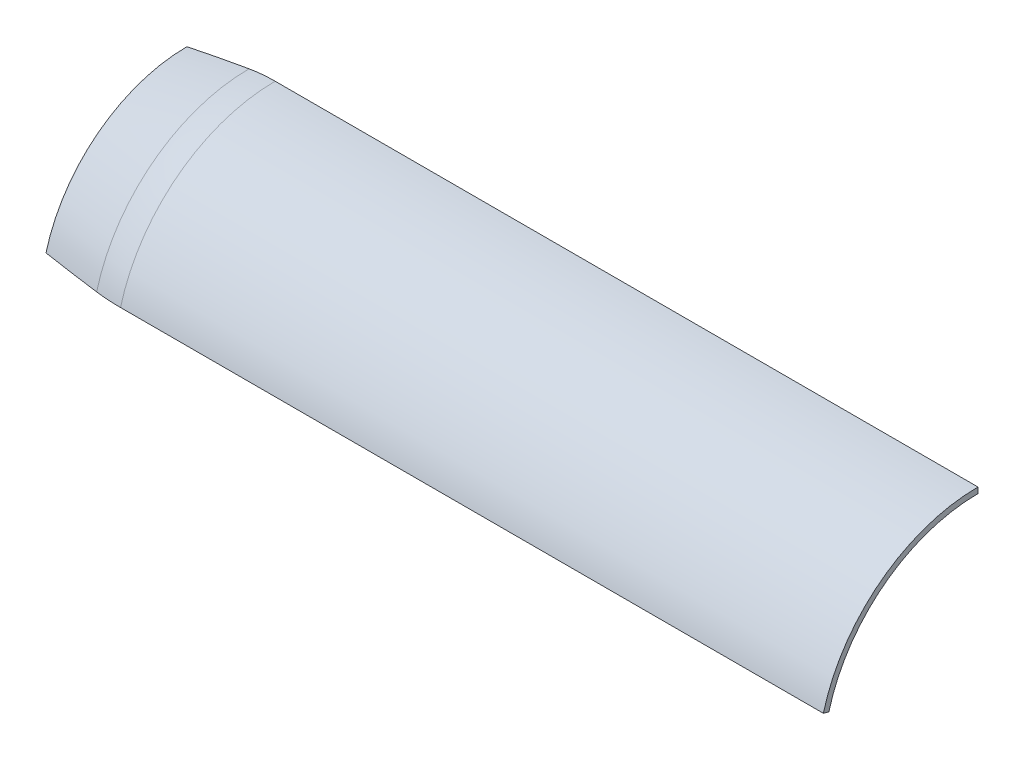
from build123d import *

# Parameters (mm, degrees)
REVOLVE1_ANGLE     = 75
FILLET1_R          = 80
FILLET2_R          = 80
SKETCH3_W          = 220
SKETCH3_H          = 208.906104004
CUT_EXTRUDE3_DEPTH = 159


with BuildPart() as part:
    # Sketch1 → Revolve1 (revolve)
    with BuildSketch(Plane.XY):
        with BuildLine():
            Line((0, 0), (3.000014971, 0))
            Line((3.000014971, 0), (2.999985029, 0.009477573))
            add(Edge.make_bspline(
                [(2.999985029, 0.009477573), (2.993785153, 1.971956174), (2.98195041, 5.919056141), (3.145368661, 11.706950418), (3.673805689, 17.348455242), (4.826995442, 22.758009885), (6.767385374, 27.848912294), (10.462264152, 34.106073266), (16.932254921, 40.80886219), (26.377617743, 47.258644811), (36.67301066, 52.572311975), (47.441384771, 57.081049673), (62.17748954, 62.31037411), (81.042213455, 67.757539775), (104.018152235, 73.218909741), (126.982089983, 77.893970447), (142.347775171, 80.65244689), (149.958103424, 81.949720096), (150, 81.956859546)],
                knots=[0, 0, 0, 0, 0.03125, 0.0625, 0.09375, 0.125, 0.15625, 0.1875, 0.25, 0.3125, 0.375, 0.4375, 0.5, 0.625, 0.75, 0.875, 0.996633751, 0.997307001, 0.997307001, 0.997307001, 0.997307001], degree=3))
            Line((150, 81.956859546), (530, 81.956859546))
            Line((530, 81.956859546), (530, 85))
            Line((530, 85), (150, 85))
            add(Edge.make_bspline(
                [(0, 0), (-0.012294225, 3.891554312), (-0.027437579, 8.684958126), (0.361573767, 14.085722357), (0.576098453, 16.090496183), (0.782493435, 17.604822189), (0.986227589, 18.854298664), (1.188670863, 19.931536976), (1.390404268, 20.885679324), (1.591698837, 21.746529091), (1.792703864, 22.533746067), (1.993507167, 23.261083862), (2.253808552, 24.139979457), (2.580573656, 25.146175179), (2.983585386, 26.259501153), (3.385879093, 27.271261727), (3.787683439, 28.201566994), (4.189138614, 29.064817448), (4.590335615, 29.871726974), (5.05331092, 30.74778076), (5.583218589, 31.683457084), (6.185429632, 32.669732492), (6.787226927, 33.590624245), (7.451481511, 34.546094958), (8.182770444, 35.530963646), (8.985083876, 36.540013411), (9.850344603, 37.562485558), (10.782608842, 38.595746542), (11.785011743, 39.636928062), (12.851029789, 40.680352273), (13.983960321, 41.72463117), (15.186170623, 42.768194245), (16.387975322, 43.755294725), (17.654380903, 44.743506811), (18.987602276, 45.731471932), (20.389198856, 46.717890971), (21.790522044, 47.657861765), (23.257103599, 48.59836715), (24.790441056, 49.538186318), (26.391587757, 50.476245251), (28.05829275, 51.412163763), (29.791720393, 52.345056651), (31.59268286, 53.274185034), (33.459445798, 54.199628429), (35.392909821, 55.120726442), (37.459746918, 56.067201212), (39.59327023, 57.006562681), (41.860151348, 57.96659169), (44.193707143, 58.917521836), (46.660609333, 59.885320784), (49.260404933, 60.867669295), (51.99403381, 61.861671206), (54.860992187, 62.865616104), (57.794602823, 63.85555089), (60.861539281, 64.853573463), (64.06149587, 65.858380358), (67.461497598, 66.888166734), (70.995135905, 67.920234745), (74.662088876, 68.953918346), (78.462130407, 69.988575944), (82.462197069, 71.040436012), (86.662284614, 72.107100186), (91.062388571, 73.18640193), (95.662505252, 74.276388609), (100.462631288, 75.375305679), (105.462763855, 76.481579791), (110.662900527, 77.593803027), (116.063039296, 78.710717608), (121.663178505, 79.831201671), (127.529872228, 80.967142806), (133.663251007, 82.116215238), (140.063409966, 83.276352633), (145.198462089, 84.177415336), (148.333178957, 84.715838785), (149.39998937, 84.897876633), (149.733326587, 84.954653305), (149.933332963, 84.98866355), (150, 85)],
                knots=[0, 0, 0, 0, 0.061462209, 0.075705788, 0.085548437, 0.093321935, 0.099856333, 0.105553797, 0.110642995, 0.115267654, 0.119524592, 0.123482434, 0.127191759, 0.134010181, 0.140199136, 0.145901384, 0.151215493, 0.156212588, 0.160945789, 0.165455878, 0.171870938, 0.177937368, 0.183716425, 0.189254732, 0.196326298, 0.203099892, 0.209625632, 0.217492532, 0.225090541, 0.232464167, 0.24106462, 0.249438142, 0.257620809, 0.265641058, 0.274822876, 0.28384341, 0.292725747, 0.301488561, 0.311376345, 0.321146599, 0.330814589, 0.341584449, 0.352255608, 0.362840299, 0.374512001, 0.386101174, 0.398765505, 0.411352526, 0.425006218, 0.438588433, 0.453231339, 0.468927603, 0.484557057, 0.501237456, 0.517857889, 0.535527769, 0.554243231, 0.574001115, 0.593705628, 0.614453399, 0.636242373, 0.65907093, 0.682937829, 0.707842151, 0.733783254, 0.760760729, 0.78877436, 0.81782409, 0.847909993, 0.879032247, 0.912262482, 0.946527454, 0.981827786, 0.994656092, 0.99679374, 0.998931275, 1, 1, 1, 1], degree=3))
        make_face()
    revolve(axis=Axis((0, 0, 0), (1, 0, 0)), revolution_arc=REVOLVE1_ANGLE)

    # Fillet1
    fillet1_edges = [part.edges().sort_by_distance(p)[0] for p in [
        (150, 65.020748281, 49.892174934),
    ]]
    fillet(fillet1_edges, radius=FILLET1_R)

    # Fillet2
    fillet2_edges = [part.edges().sort_by_distance(p)[0] for p in [
        (150, 67.435033925, 51.744721466),
    ]]
    fillet(fillet2_edges, radius=FILLET2_R)

    # Sketch3 → Cut-Extrude3 (cut)
    with BuildSketch(Plane(origin=(0, 0, 0), x_dir=(1, 0, 0), z_dir=(0, 1, 0))):
        Rectangle(SKETCH3_W, SKETCH3_H)
    extrude(amount=CUT_EXTRUDE3_DEPTH, mode=Mode.SUBTRACT)


solid = part.part
